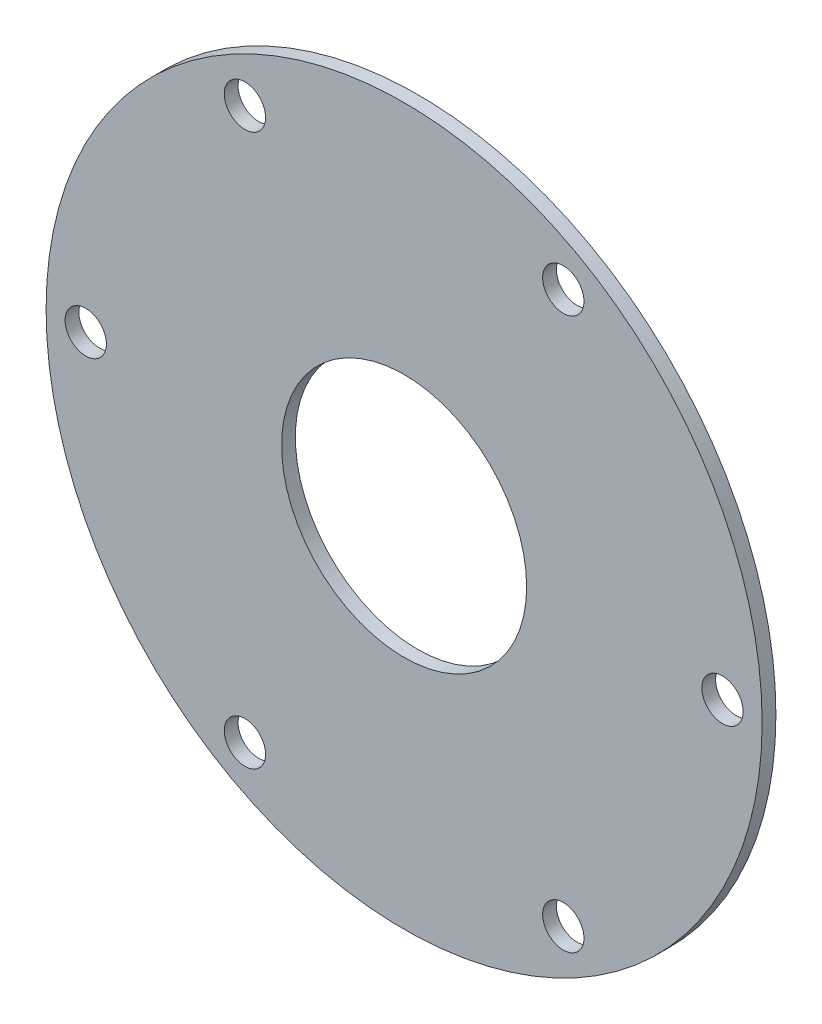
from build123d import *

# Parameters (mm, degrees)
CROQUIS1_R              = 26
CROQUIS1_R_2            = 1.5
CROQUIS1_R_3            = 8.9
SALIENTE_EXTRUIR1_DEPTH = 1


with BuildPart() as part:
    # Croquis1 → Saliente-Extruir1 (new body)
    with BuildSketch(Plane.XY):
        Circle(CROQUIS1_R)
        with Locations((-11.56, -20.022507335)):
            Circle(CROQUIS1_R_2, mode=Mode.SUBTRACT)
        with Locations((11.56, -20.022507335)):
            Circle(CROQUIS1_R_2, mode=Mode.SUBTRACT)
        with Locations((23.12, 0)):
            Circle(CROQUIS1_R_2, mode=Mode.SUBTRACT)
        with Locations((-23.12, 0)):
            Circle(CROQUIS1_R_2, mode=Mode.SUBTRACT)
        with Locations((-11.56, 20.022507335)):
            Circle(CROQUIS1_R_2, mode=Mode.SUBTRACT)
        Circle(CROQUIS1_R_3, mode=Mode.SUBTRACT)
        with Locations((11.56, 20.022507335)):
            Circle(CROQUIS1_R_2, mode=Mode.SUBTRACT)
    extrude(amount=SALIENTE_EXTRUIR1_DEPTH)


solid = part.part
